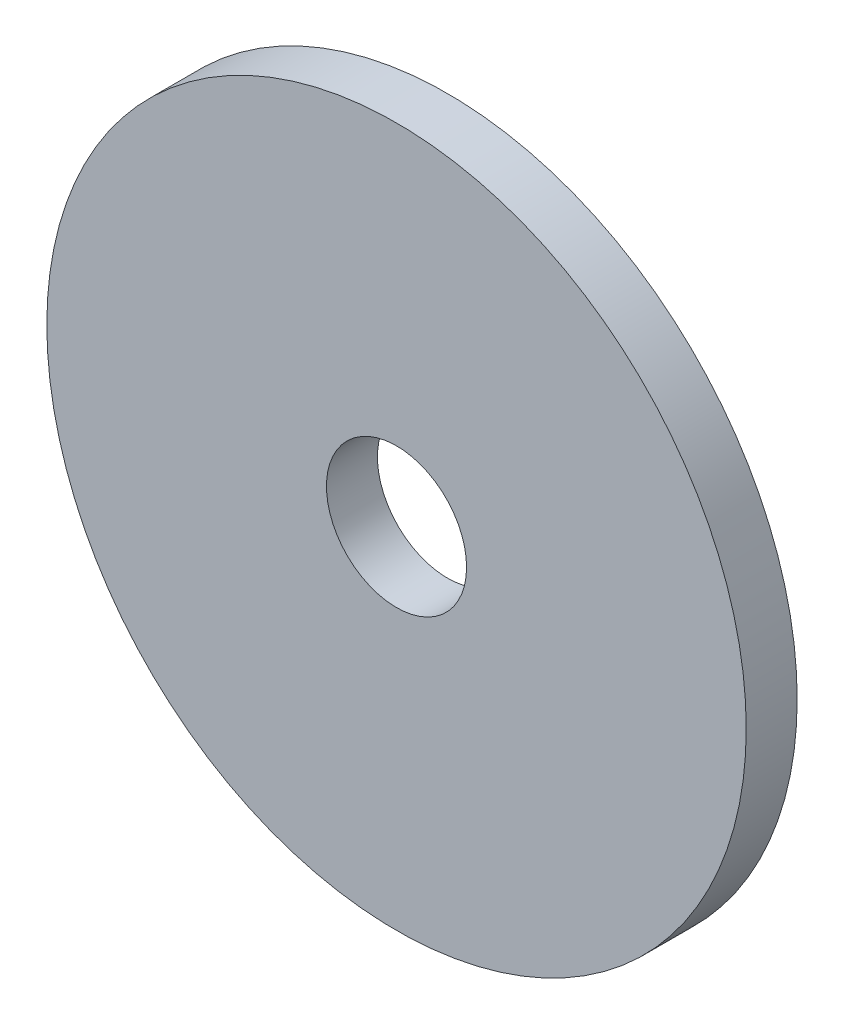
from build123d import *

# Parameters (mm, degrees)
SKETCH2_R           = 20.592109163
SKETCH2_R_2         = 4.125
BOSS_EXTRUDE1_DEPTH = 3


# Read off the part's stored shape, not the designer's step: Gear 60pitch part02.STEP
with BuildPart() as part:
    # Sketch2 → Boss-Extrude1 (new body)
    with BuildSketch(Plane.XY.offset(1)):
        Circle(SKETCH2_R)
        Circle(SKETCH2_R_2, mode=Mode.SUBTRACT)
    extrude(amount=BOSS_EXTRUDE1_DEPTH)


solid = part.part
